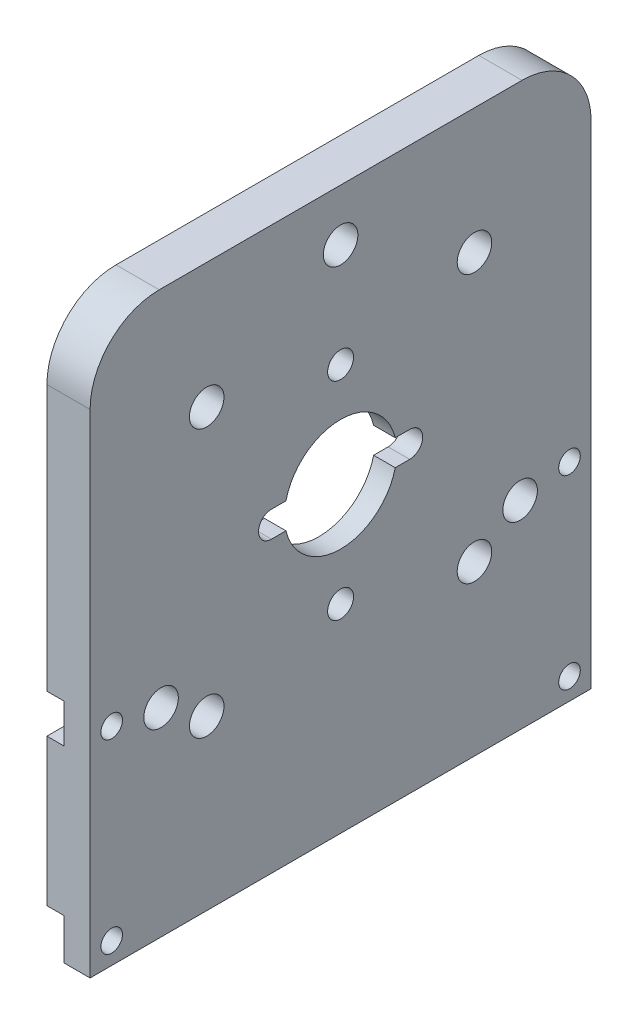
from build123d import *

# Parameters (mm, degrees)
RESSALTO_EXTRUS_O1_DEPTH  = 29
CORTE_EXTRUS_O1_REACH     = 115.6
ESBO_O2_R                 = 6.5
ESBO_O3_R                 = 18
CORTE_EXTRUS_O2_DEPTH     = 2.5
CORTE_EXTRUS_O3_START     = -5
ESBO_O5_R                 = 2
ESBO_O5_R_2               = 1.5
CORTE_EXTRUS_O3_DEPTH     = 5
ESBO_O7_R                 = 12
ESBO_O7_R_2               = 2
CORTE_EXTRUS_O4_DEPTH     = 110.590145542
ESBO_O11_W                = 18
ESBO_O11_H                = 10
RESSALTO_EXTRUS_O3_DEPTH  = 8
ESBO_O12_W                = 14.4
ESBO_O12_H                = 6.8
CORTE_EXTRUS_O6_DEPTH     = 3
ESBO_O13_W                = 13.4
ESBO_O13_H                = 5.8
CORTE_EXTRUS_O7_DEPTH     = 5
CORTE_EXTRUS_O8_REACH     = 84.898
RESSALTO_EXTRUS_O4_DEPTH  = 5
ESBO_O17_W                = 2.6
ESBO_O17_H                = 10
RESSALTO_EXTRUS_O5_DEPTH  = 8
CHANFRO1_SIZE             = 5
FILETE1_R                 = 8
ESBO_O18_W                = 20
ESBO_O18_H                = 8
RESSALTO_EXTRUS_O6_DEPTH  = 13
ESBO_O19_R                = 2.25
CORTE_EXTRUS_O9_DEPTH     = 80.252760204
CHANFRO2_SIZE             = 3
CHANFRO2_SIZE_2           = 13
CORTE_EXTRUS_O10_START    = -6
CORTE_EXTRUS_O10_DEPTH    = 74.252760204
ESBO_O21_W                = 26
ESBO_O21_H                = 16
RESSALTO_EXTRUS_O7_DEPTH  = 30
CORTE_EXTRUS_O11_DEPTH    = 26
ESBO_O24_R                = 1
ESBO_O24_W                = 17.2
ESBO_O24_H                = 3
RESSALTO_EXTRUS_O8_DEPTH  = 3
ESBO_O25_W                = 11.2
ESBO_O25_H                = 4
CORTE_EXTRUS_O12_DEPTH    = 2
ESBO_O26_R                = 3.5
CORTE_EXTRUS_O13_DEPTH    = 96.289033997
ESBO_O27_W                = 24
ESBO_O27_H                = 8
RESSALTO_EXTRUS_O9_DEPTH  = 6
ESBO_O28_W                = 1.5
ESBO_O28_H                = 8
RESSALTO_EXTRUS_O10_DEPTH = 2
ESBO_O31_R                = 1
CORTE_EXTRUS_O14_DEPTH    = 85.172442046
ESBO_O32_R                = 1
CORTE_EXTRUS_O15_DEPTH    = 12
ESBO_O33_R                = 1.25
CORTE_EXTRUS_O16_DEPTH    = 5
CORTE_EXTRUS_O17_DEPTH    = 2
ESBO_O37_R                = 54.092518309
CORTE_EXTRUS_O19_DEPTH    = 114.723348526


with BuildPart() as part:
    # Esboço1 → Ressalto-extrusão1 (new, symmetric)
    with BuildSketch(Plane.XY):
        Polygon((0, 0), (-41, 0), (-41, 60), (-46, 60), (-46, -5), (46, -5), (46, 60), (41, 60), (41, 0), align=None)
    extrude(amount=RESSALTO_EXTRUS_O1_DEPTH, both=True)

    # Esboço2 → Corte-extrusão1 (cut, up to next)
    with BuildSketch(Plane.ZY.offset(46), mode=Mode.PRIVATE) as corte_extrus_o1_sk1:
        with Locations(Location((0, 30, 0), (0, 0, 270))):
            Circle(ESBO_O2_R)
    corte_extrus_o1_tool1 = extrude(corte_extrus_o1_sk1.sketch, amount=-CORTE_EXTRUS_O1_REACH, mode=Mode.PRIVATE) & part.part
    add(corte_extrus_o1_tool1.solids().sort_by_distance((-46, 30, 0))[0], mode=Mode.SUBTRACT)

    # Esboço3 → Corte-extrusão2 (cut)
    with BuildSketch(Plane.ZY.offset(46)):
        with Locations(Location((0, 30, 0), (0, 0, 270))):
            Circle(ESBO_O3_R)
    extrude(amount=-CORTE_EXTRUS_O2_DEPTH, mode=Mode.SUBTRACT)

    # Esboço5 → Corte-extrusão3 (cut)
    with BuildSketch(Plane.ZY.offset(46).offset(CORTE_EXTRUS_O3_START)):
        with Locations(Location((-15.5, 45.5, 0), (0, 0, 270))):
            Circle(ESBO_O5_R)
        with Locations(Location((0, 42, 0), (0, 0, 270))):
            Circle(ESBO_O5_R_2)
        with Locations(Location((0, 18, 0), (0, 0, 270))):
            Circle(ESBO_O5_R_2)
        with Locations(Location((0, 54, 0), (0, 0, 270))):
            Circle(ESBO_O5_R)
        with Locations(Location((15.5, 45.5, 0), (0, 0, 270))):
            Circle(ESBO_O5_R)
        with Locations(Location((15.5, 14.5, 0), (0, 0, 270))):
            Circle(ESBO_O5_R)
        with Locations(Location((-15.5, 14.5, 0), (0, 0, 270))):
            Circle(ESBO_O5_R)
        with Locations(Location((20.784609691, 18, 0), (0, 0, 270))):
            Circle(ESBO_O5_R)
        with Locations(Location((-20.784609691, 18, 0), (0, 0, 270))):
            Circle(ESBO_O5_R)
        with BuildLine():
            Line((-8, 31.5), (8, 31.5))
            ThreePointArc((8, 31.5), (9.5, 30), (8, 28.5))
            Line((8, 28.5), (-8, 28.5))
            ThreePointArc((-8, 28.5), (-9.5, 30), (-8, 31.5))
        make_face()
    extrude(amount=CORTE_EXTRUS_O3_DEPTH, mode=Mode.SUBTRACT)

    # Esboço7 → Corte-extrusão4 (cut, through all)
    with BuildSketch(Plane.ZY.offset(-41)):
        with Locations(Location((0, 30, 0), (0, 0, 270))):
            Circle(ESBO_O7_R)
        with Locations(Location((-15.5, 45.5, 0), (0, 0, 270))):
            Circle(ESBO_O7_R_2)
        with Locations(Location((15.5, 45.5, 0), (0, 0, 270))):
            Circle(ESBO_O7_R_2)
        with Locations(Location((15.5, 14.5, 0), (0, 0, 270))):
            Circle(ESBO_O7_R_2)
        with Locations(Location((-15.5, 14.5, 0), (0, 0, 270))):
            Circle(ESBO_O7_R_2)
    extrude(amount=-CORTE_EXTRUS_O4_DEPTH, mode=Mode.SUBTRACT)

    # Esboço11 → Ressalto-extrusão3 (add)
    with BuildSketch(Plane(origin=(0, 0, 0), x_dir=(1, 0, 0), z_dir=(0, 1, 0))):
        with Locations((-29.4, 0)):
            Rectangle(ESBO_O11_W, ESBO_O11_H)
    extrude(amount=RESSALTO_EXTRUS_O3_DEPTH)

    # Esboço12 → Corte-extrusão6 (cut)
    with BuildSketch(Plane(origin=(0, 8, 0), x_dir=(1, 0, 0), z_dir=(0, 1, 0))):
        with Locations((-29.4, 0)):
            Rectangle(ESBO_O12_W, ESBO_O12_H)
    extrude(amount=-CORTE_EXTRUS_O6_DEPTH, mode=Mode.SUBTRACT)

    # Esboço13 → Corte-extrusão7 (cut)
    with BuildSketch(Plane(origin=(0, 5, 0), x_dir=(1, 0, 0), z_dir=(0, 1, 0))):
        with Locations((-29.4, 0)):
            Rectangle(ESBO_O13_W, ESBO_O13_H)
    extrude(amount=-CORTE_EXTRUS_O7_DEPTH, mode=Mode.SUBTRACT)

    # Esboço14 → Corte-extrusão8 (cut, up to next)
    with BuildSketch(Plane.XY.offset(5), mode=Mode.PRIVATE) as corte_extrus_o8_sk1:
        with BuildLine():
            Line((-33.4, 0), (-25.4, 0))
            ThreePointArc((-25.4, 0), (-29.4, 4), (-33.4, 0))
        make_face()
    corte_extrus_o8_tool1 = extrude(corte_extrus_o8_sk1.sketch, amount=-CORTE_EXTRUS_O8_REACH, mode=Mode.PRIVATE) & part.part
    add(corte_extrus_o8_tool1.solids().sort_by_distance((-29.4, 1.697653, 5))[0], mode=Mode.SUBTRACT)

    # Esboço16 → Ressalto-extrusão4 (add)
    with BuildSketch(Plane.XY.offset(29)):
        Polygon((-41, 32), (-21, 12), (21, 12), (41, 32), (41, 0), (-41, 0), align=None)
    ressalto_extrus_o4 = extrude(amount=-RESSALTO_EXTRUS_O4_DEPTH)

    # Espelhar1: Ressalto-extrusão4 across plane
    add(ressalto_extrus_o4.mirror(Plane.XY))

    # Esboço17 → Ressalto-extrusão5 (add)
    with BuildSketch(Plane(origin=(0, 8, 0), x_dir=(1, 0, 0), z_dir=(0, 1, 0))):
        with Locations((-39.7, 0)):
            Rectangle(ESBO_O17_W, ESBO_O17_H)
    extrude(amount=-RESSALTO_EXTRUS_O5_DEPTH)

    # Chanfro1
    chanfro1_edges = [part.edges().sort_by_distance(p)[0] for p in [
        (41, 0, 0),
        (-41, 0, 14.5),
        (-41, 0, -14.5),
    ]]
    chamfer(chanfro1_edges, length=CHANFRO1_SIZE)

    # Filete1
    filete1_edges = [part.edges().sort_by_distance(p)[0] for p in [
        (-43.5, 60, -29),
        (-43.5, 60, 29),
        (-41, 32, 26.5),
        (-21, 12, 26.5),
        (21, 12, 26.5),
        (41, 32, 26.5),
        (-41, 32, -26.5),
        (41, 32, -26.5),
        (21, 12, -26.5),
        (-21, 12, -26.5),
        (43.5, 60, 29),
        (43.5, 60, -29),
    ]]
    fillet(filete1_edges, radius=FILETE1_R)

    # Esboço18 → Ressalto-extrusão6 (add)
    with BuildSketch(Plane.XY.offset(29)):
        with Locations((22, 7)):
            Rectangle(ESBO_O18_W, ESBO_O18_H)
    extrude(amount=RESSALTO_EXTRUS_O6_DEPTH)

    # Esboço19 → Corte-extrusão9 (cut, through all)
    with BuildSketch(Plane(origin=(0, 11, 0), x_dir=(1, 0, 0), z_dir=(0, 1, 0))):
        with Locations(Location((18, -35.75, 0), (0, 0, 270))):
            Circle(ESBO_O19_R)
        with Locations(Location((26, -35.75, 0), (0, 0, 270))):
            Circle(ESBO_O19_R)
    extrude(amount=-CORTE_EXTRUS_O9_DEPTH, mode=Mode.SUBTRACT)

    # Chanfro2
    # the kernel refuses this chamfer: 13, 3 mm, written as the material it adds along each edge
    with BuildSketch(Plane(origin=(12, 3, 29), x_dir=(0, -0.987043568605235, -0.1604524654688814), z_dir=(1, 0, 0))) as chanfro2_piece_1_section:
        Polygon((CHANFRO2_SIZE * 0.987043568605, -CHANFRO2_SIZE * 0.160452465469), (-CHANFRO2_SIZE_2 * 0.160452465469, -CHANFRO2_SIZE_2 * 0.987043568605), (0, 0), align=None)
    chanfro2_piece_1 = extrude(amount=20, mode=Mode.PRIVATE)
    chanfro2_piece_1 = split(chanfro2_piece_1, bisect_by=Plane(origin=(21.999997786, 2.099377296, 42), z_dir=(0, 0, -1)), keep=Keep.TOP, mode=Mode.PRIVATE)
    chanfro2_piece_1 = chanfro2_piece_1 - Plane(origin=(18, 2.099377296, 35.75), x_dir=(0, 0, 1), z_dir=(0, 1, 0)) * Cylinder(2.25, 92, mode=Mode.PRIVATE)
    chanfro2_piece_1 = chanfro2_piece_1 - Plane(origin=(26, 2.099377296, 35.75), x_dir=(0, 0, 1), z_dir=(0, 1, 0)) * Cylinder(2.25, 92, mode=Mode.PRIVATE)
    add(chanfro2_piece_1)

    # Esboço20 → Corte-extrusão10 (cut, through all)
    with BuildSketch(Plane(origin=(0, 11, 0), x_dir=(1, 0, 0), z_dir=(0, 1, 0)).offset(CORTE_EXTRUS_O10_START)):
        with BuildLine():
            Line((18, -31.5), (26, -31.5))
            ThreePointArc((26, -31.5), (30.25, -35.75), (26, -40))
            Line((26, -40), (18, -40))
            ThreePointArc((18, -40), (13.75, -35.75), (18, -31.5))
        make_face()
    extrude(amount=-CORTE_EXTRUS_O10_DEPTH, mode=Mode.SUBTRACT)

    # Esboço21 → Ressalto-extrusão7 (add)
    with BuildSketch(Plane(origin=(0, 0, 0), x_dir=(1, 0, 0), z_dir=(0, 1, 0))):
        with Locations((-1, 0)):
            Rectangle(ESBO_O21_W, ESBO_O21_H)
    extrude(amount=RESSALTO_EXTRUS_O7_DEPTH)

    # Esboço22 → Corte-extrusão11 (cut)
    with BuildSketch(Plane(origin=(12, 0, 0), x_dir=(0, 0, -1), z_dir=(1, 0, 0))):
        Polygon((6.812733176, 30), (3.406366588, 35.9), (-3.406366588, 35.9), (-6.812733176, 30), (-3.406366588, 24.1), (3.406366588, 24.1), align=None)
    extrude(amount=-CORTE_EXTRUS_O11_DEPTH, mode=Mode.SUBTRACT)

    # Esboço24 → Ressalto-extrusão8 (add)
    # profile 1 of 2: a face of its own
    with BuildSketch(Plane(origin=(0, 0, 0), x_dir=(1, 0, 0), z_dir=(0, 1, 0))):
        with BuildLine():
            Line((17.282291959, 14), (32.482291959, 14))
            ThreePointArc((32.482291959, 14), (34.482291959, 12), (32.482291959, 10))
            Line((32.482291959, 10), (17.282291959, 10))
            ThreePointArc((17.282291959, 10), (15.282291959, 12), (17.282291959, 14))
        make_face()
        with Locations(Location((17.282291959, 12, 0), (0, 0, 180))):
            Circle(ESBO_O24_R, mode=Mode.SUBTRACT)
        with Locations(Location((32.482291959, 12, 0), (0, 0, 180))):
            Circle(ESBO_O24_R, mode=Mode.SUBTRACT)
    # profile 2 of 2: a face of its own
    with BuildSketch(Plane(origin=(0, 0, 0), x_dir=(1, 0, 0), z_dir=(0, 1, 0))):
        with Locations((24.882291959, -8.5)):
            Rectangle(ESBO_O24_W, ESBO_O24_H)
    extrude(amount=RESSALTO_EXTRUS_O8_DEPTH)

    # Esboço25 → Corte-extrusão12 (cut)
    with BuildSketch(Plane(origin=(0, 3, 0), x_dir=(1, 0, 0), z_dir=(0, 1, 0))):
        with Locations((24.882291959, 12)):
            Rectangle(ESBO_O25_W, ESBO_O25_H)
    extrude(amount=-CORTE_EXTRUS_O12_DEPTH, mode=Mode.SUBTRACT)

    # Esboço26 → Corte-extrusão13 (cut, through all)
    with BuildSketch(Plane.XY.offset(29)):
        with Locations((36, 5)):
            Circle(ESBO_O26_R)
    extrude(amount=-CORTE_EXTRUS_O13_DEPTH, mode=Mode.SUBTRACT)

    # Esboço27 → Ressalto-extrusão9 (add)
    with BuildSketch(Plane(origin=(0, 0, 0), x_dir=(1, 0, 0), z_dir=(0, 1, 0))):
        with Locations((-4, 16)):
            Rectangle(ESBO_O27_W, ESBO_O27_H)
    extrude(amount=RESSALTO_EXTRUS_O9_DEPTH)

    # Esboço28 → Ressalto-extrusão10 (add)
    with BuildSketch(Plane(origin=(0, 6, 0), x_dir=(1, 0, 0), z_dir=(0, 1, 0))):
        with Locations((-15.25, 16)):
            Rectangle(ESBO_O28_W, ESBO_O28_H)
        with Locations((7.25, 16)):
            Rectangle(ESBO_O28_W, ESBO_O28_H)
    extrude(amount=RESSALTO_EXTRUS_O10_DEPTH)

    # Esboço31 → Corte-extrusão14 (cut, through all)
    with BuildSketch(Plane.XY.offset(8)):
        with Locations((-10, 22.5)):
            Circle(ESBO_O31_R)
        with Locations((8, 22.5)):
            Circle(ESBO_O31_R)
    extrude(amount=-CORTE_EXTRUS_O14_DEPTH, mode=Mode.SUBTRACT)

    # Esboço32 → Corte-extrusão15 (cut)
    with BuildSketch(Plane.ZY.offset(46)):
        with Locations(Location((-26.5, -2.5, 0), (0, 0, 270))):
            Circle(ESBO_O32_R)
        with Locations(Location((-26.5, 19, 0), (0, 0, 270))):
            Circle(ESBO_O32_R)
        with Locations(Location((26.5, 19, 0), (0, 0, 90))):
            Circle(ESBO_O32_R)
        with Locations(Location((26.5, -2.5, 0), (0, 0, 90))):
            Circle(ESBO_O32_R)
    corte_extrus_o15 = extrude(amount=-CORTE_EXTRUS_O15_DEPTH, mode=Mode.SUBTRACT)

    # Esboço33 → Corte-extrusão16 (cut)
    with BuildSketch(Plane.ZY.offset(46)):
        with Locations(Location((-26.5, -2.5, 0), (0, 0, 270))):
            Circle(ESBO_O33_R)
        with Locations(Location((-26.5, 19, 0), (0, 0, 270))):
            Circle(ESBO_O33_R)
        with Locations(Location((26.5, 19, 0), (0, 0, 90))):
            Circle(ESBO_O33_R)
        with Locations(Location((26.5, -2.5, 0), (0, 0, 90))):
            Circle(ESBO_O33_R)
    corte_extrus_o16 = extrude(amount=-CORTE_EXTRUS_O16_DEPTH, mode=Mode.SUBTRACT)

    # Esboço34 → Corte-extrusão17 (cut)
    with BuildSketch(Plane.ZY.offset(46)):
        with BuildLine():
            Line((-26.5, -0.25), (-29, -0.25))
            Line((-29, -0.25), (-29, -5))
            Line((-29, -5), (-24.25, -5))
            Line((-24.25, -5), (-24.25, -2.5))
            ThreePointArc((-24.25, -2.5), (-24.909009742, -0.909009742), (-26.5, -0.25))
        make_face()
        with BuildLine():
            Line((-26.5, 21.25), (-29, 21.25))
            Line((-29, 21.25), (-29, 16.75))
            Line((-29, 16.75), (-26.5, 16.75))
            ThreePointArc((-26.5, 16.75), (-24.25, 19), (-26.5, 21.25))
        make_face()
        with BuildLine():
            Line((29, 16.75), (29, 21.25))
            Line((29, 21.25), (26.5, 21.25))
            ThreePointArc((26.5, 21.25), (24.25, 19), (26.5, 16.75))
            Line((26.5, 16.75), (29, 16.75))
        make_face()
        with BuildLine():
            Line((29, -5), (24.25, -5))
            Line((24.25, -5), (24.25, -2.5))
            ThreePointArc((24.25, -2.5), (24.909009742, -0.909009742), (26.5, -0.25))
            Line((26.5, -0.25), (29, -0.25))
            Line((29, -0.25), (29, -5))
        make_face()
    corte_extrus_o17 = extrude(amount=-CORTE_EXTRUS_O17_DEPTH, mode=Mode.SUBTRACT)

    # Espelhar2: Corte-extrusão15, Corte-extrusão16, Corte-extrusão17 across plane
    add(corte_extrus_o15.mirror(Plane(origin=(0, 0, 0), x_dir=(0, 0, 1), z_dir=(1, 0, 0))), mode=Mode.SUBTRACT)
    add(corte_extrus_o16.mirror(Plane(origin=(0, 0, 0), x_dir=(0, 0, 1), z_dir=(1, 0, 0))), mode=Mode.SUBTRACT)
    add(corte_extrus_o17.mirror(Plane(origin=(0, 0, 0), x_dir=(0, 0, 1), z_dir=(1, 0, 0))), mode=Mode.SUBTRACT)

    # Esboço37 → Corte-extrusão19 (cut, through all)
    with BuildSketch(Plane(origin=(-41, 0, 0), x_dir=(0, 0, -1), z_dir=(1, 0, 0))):
        with Locations((0, 30)):
            Circle(ESBO_O37_R)
    extrude(amount=CORTE_EXTRUS_O19_DEPTH, mode=Mode.SUBTRACT)


solid = part.part
